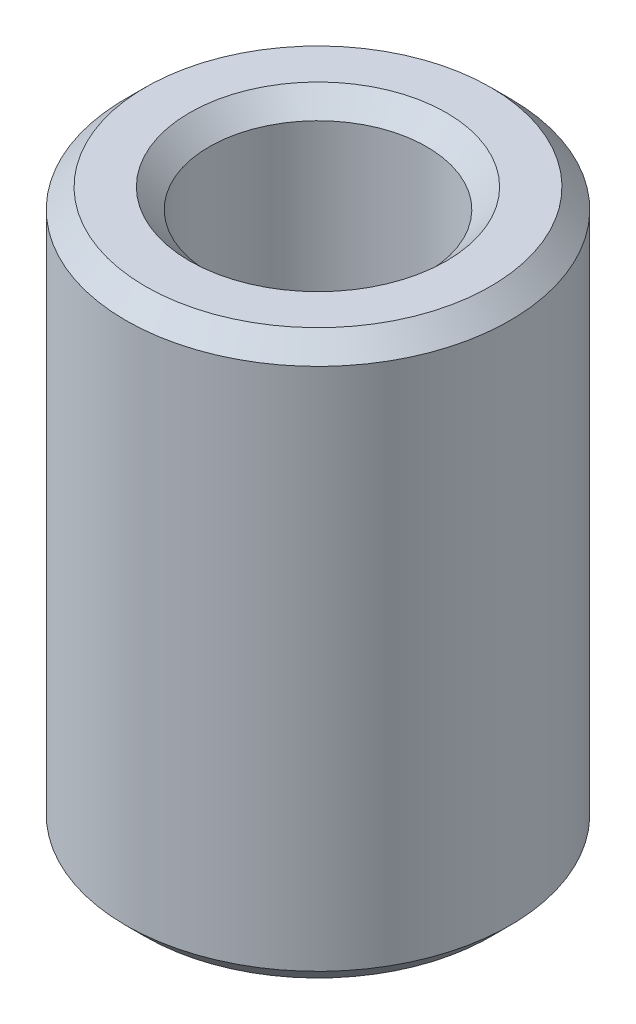
from build123d import *

# Parameters (mm, degrees)
SKETCH1_R           = 27.5
BOSS_EXTRUDE1_DEPTH = 80.59574187
SKETCH2_R           = 15.565571035
CUT_EXTRUDE1_DEPTH  = 90.48839929
CHAMFER1_SIZE       = 2.812660626


with BuildPart() as part:
    # Sketch1 → Boss-Extrude1 (new body)
    with BuildSketch(Plane(origin=(0, 0, 0), x_dir=(1, 0, 0), z_dir=(0, 1, 0))):
        Circle(SKETCH1_R)
    extrude(amount=BOSS_EXTRUDE1_DEPTH)

    # Sketch2 → Cut-Extrude1 (cut, through all)
    with BuildSketch(Plane(origin=(0, 0, 0), x_dir=(1, 0, 0), z_dir=(0, 1, 0))):
        Circle(SKETCH2_R)
    extrude(amount=CUT_EXTRUDE1_DEPTH, mode=Mode.SUBTRACT)

    # Chamfer1
    chamfer1_edges = [part.edges().sort_by_distance(p)[0] for p in [
        (-15.565571035, 80.59574187, 0),
        (-15.565571035, 0, 0),
        (-27.5, 0, 0),
        (-27.5, 80.59574187, 0),
    ]]
    chamfer(chamfer1_edges, length=CHAMFER1_SIZE)


solid = part.part
